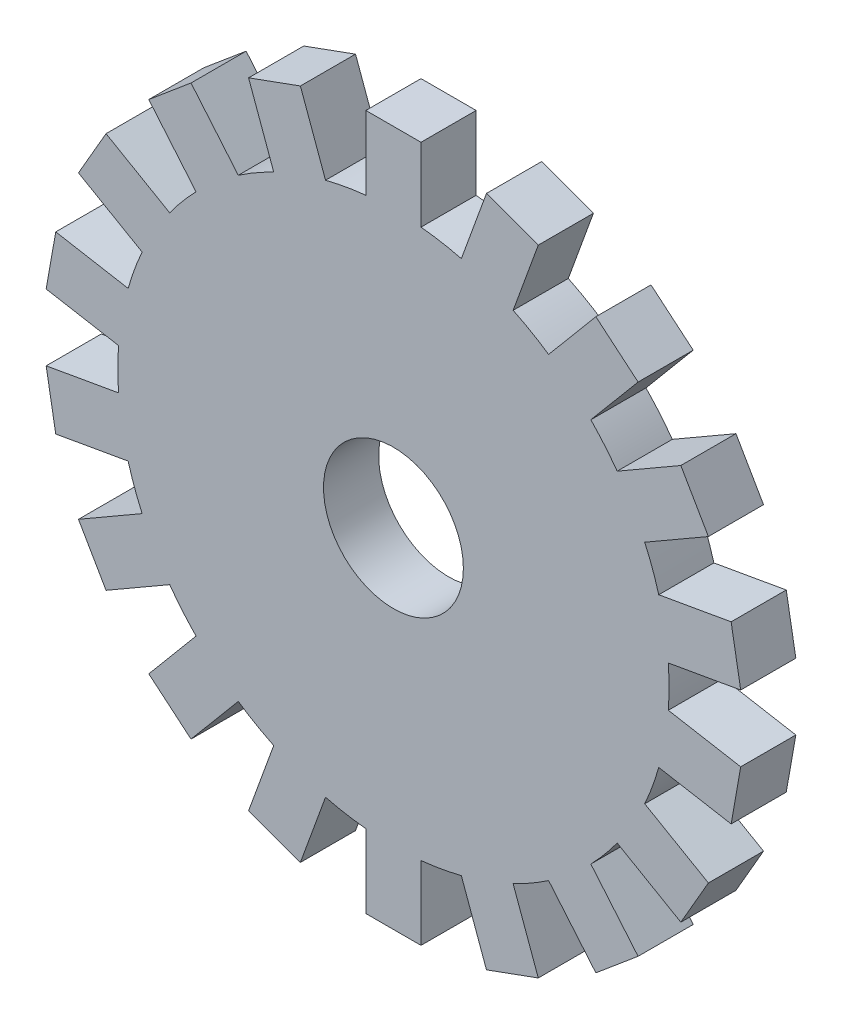
from build123d import *

# Parameters (mm, degrees)
SKETCH1_R           = 3.805758597
BOSS_EXTRUDE1_DEPTH = 1.5
BOSS_EXTRUDE2_DEPTH = 1.5
CIRPATTERN1_COUNT   = 18


with BuildPart() as part:
    # Sketch1 → Boss-Extrude1 (new, symmetric)
    with BuildSketch(Plane.XY):
        with BuildLine():
            ThreePointArc((1.5, 14.924811557), (0, 15), (-1.5, 14.924811557))
            ThreePointArc((-1.5, 14.924811557), (-10.062305899, -11.124297731), (15, 0))
            ThreePointArc((15, 0), (11.124297731, 10.062305899), (1.5, 14.924811557))
        make_face()
        Circle(SKETCH1_R, mode=Mode.SUBTRACT)
    extrude(amount=BOSS_EXTRUDE1_DEPTH, both=True)

    # Sketch1<3> → Boss-Extrude2 (add, symmetric)
    with BuildSketch(Plane.XY):
        with BuildLine():
            Line((-1.5, 18.924811557), (-1.5, 14.924811557))
            ThreePointArc((-1.5, 14.924811557), (0, 15), (1.5, 14.924811557))
            Line((1.5, 14.924811557), (1.5, 18.924811557))
            Line((1.5, 18.924811557), (-1.5, 18.924811557))
        make_face()
    boss_extrude2 = extrude(amount=BOSS_EXTRUDE2_DEPTH, both=True)

    # CirPattern1: Boss-Extrude2 ×18 about axis
    cirpattern1_axis = Axis((0, 0, 13.219379373), (0, 0, -1))
    for i in range(1, CIRPATTERN1_COUNT):
        add(boss_extrude2.rotate(cirpattern1_axis, i * 360 / CIRPATTERN1_COUNT))


solid = part.part
